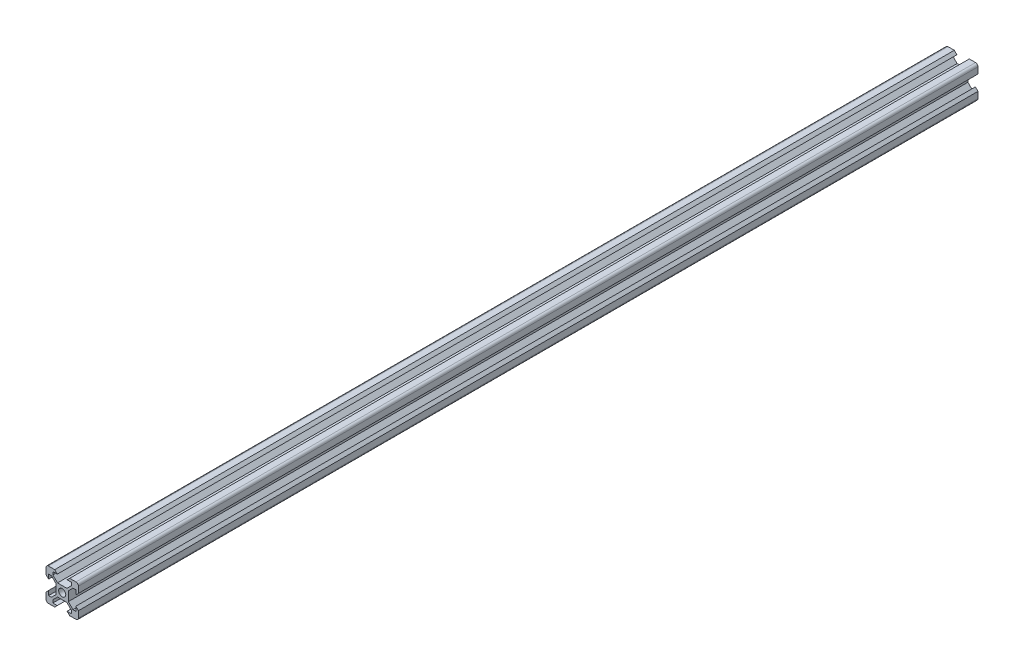
from build123d import *

# Parameters (mm, degrees)
SKETCH1_R           = 4.4
BOSS_EXTRUDE1_DEPTH = 555


with BuildPart() as part:
    # Sketch1 → Boss-Extrude1 (new, symmetric)
    with BuildSketch(Plane.XY):
        with BuildLine():
            Line((-13.271281672, 11.512), (-7.544, 5.784718328))
            Line((-7.544, 5.784718328), (-7.544, -5.784718328))
            Line((-7.544, -5.784718328), (-13.271281672, -11.512))
            Line((-13.271281672, -11.512), (-16.8, -11.512))
            Line((-16.8, -11.512), (-16.8, -6.051976926))
            Line((-16.8, -6.051976926), (-20, -9.251976926))
            Line((-20, -9.251976926), (-20, -17))
            ThreePointArc((-20, -17), (-19.121320344, -19.121320344), (-17, -20))
            Line((-17, -20), (-9.251976926, -20))
            Line((-9.251976926, -20), (-6.051976926, -16.8))
            Line((-6.051976926, -16.8), (-11.512, -16.8))
            Line((-11.512, -16.8), (-11.512, -13.271281672))
            Line((-11.512, -13.271281672), (-5.784718328, -7.544))
            Line((-5.784718328, -7.544), (5.784718328, -7.544))
            Line((5.784718328, -7.544), (11.512, -13.271281672))
            Line((11.512, -13.271281672), (11.512, -16.8))
            Line((11.512, -16.8), (6.051976926, -16.8))
            Line((6.051976926, -16.8), (9.251976926, -20))
            Line((9.251976926, -20), (17, -20))
            ThreePointArc((17, -20), (19.121320344, -19.121320344), (20, -17))
            Line((20, -17), (20, -9.251976926))
            Line((20, -9.251976926), (16.8, -6.051976926))
            Line((16.8, -6.051976926), (16.8, -11.512))
            Line((16.8, -11.512), (13.271281672, -11.512))
            Line((13.271281672, -11.512), (7.544, -5.784718328))
            Line((7.544, -5.784718328), (7.544, 5.784718328))
            Line((7.544, 5.784718328), (13.271281672, 11.512))
            Line((13.271281672, 11.512), (16.8, 11.512))
            Line((16.8, 11.512), (16.8, 6.051976926))
            Line((16.8, 6.051976926), (20, 9.251976926))
            Line((20, 9.251976926), (20, 17))
            ThreePointArc((20, 17), (19.121320344, 19.121320344), (17, 20))
            Line((17, 20), (9.251976926, 20))
            Line((9.251976926, 20), (6.051976926, 16.8))
            Line((6.051976926, 16.8), (11.512, 16.8))
            Line((11.512, 16.8), (11.512, 13.271281672))
            Line((11.512, 13.271281672), (5.784718328, 7.544))
            Line((5.784718328, 7.544), (-5.784718328, 7.544))
            Line((-5.784718328, 7.544), (-11.512, 13.271281672))
            Line((-11.512, 13.271281672), (-11.512, 16.8))
            Line((-11.512, 16.8), (-6.051976926, 16.8))
            Line((-6.051976926, 16.8), (-9.251976926, 20))
            Line((-9.251976926, 20), (-17, 20))
            ThreePointArc((-17, 20), (-19.121320344, 19.121320344), (-20, 17))
            Line((-20, 17), (-20, 9.251976926))
            Line((-20, 9.251976926), (-16.8, 6.051976926))
            Line((-16.8, 6.051976926), (-16.8, 11.512))
            Line((-16.8, 11.512), (-13.271281672, 11.512))
        make_face()
        Circle(SKETCH1_R, mode=Mode.SUBTRACT)
    extrude(amount=BOSS_EXTRUDE1_DEPTH, both=True)


solid = part.part
